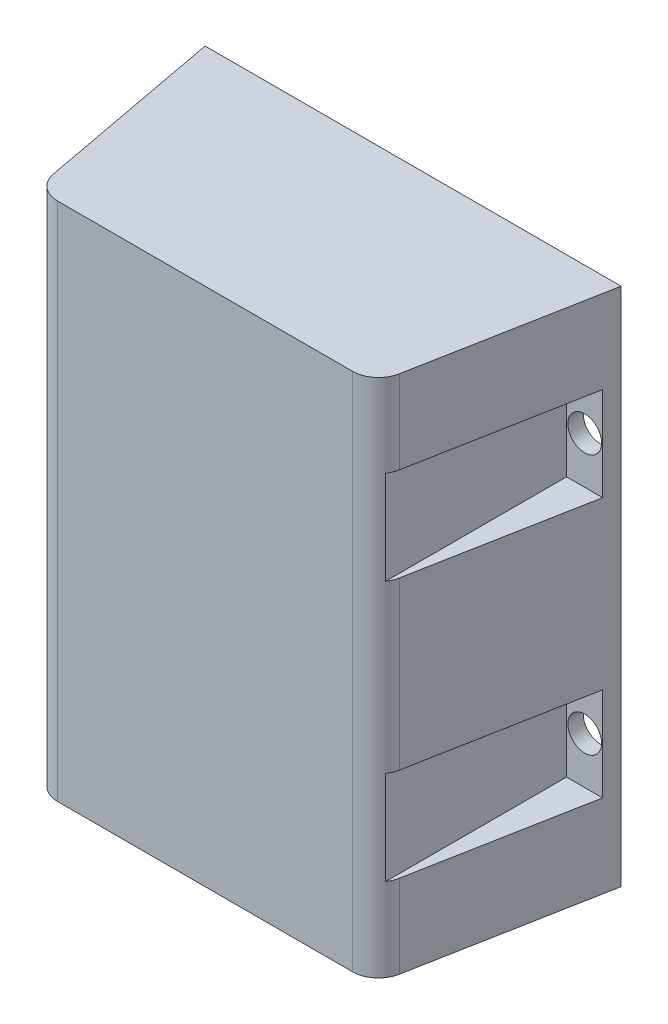
from build123d import *

# Parameters (mm, degrees)
SKETCH_1_W               = 80
SKETCH_1_H               = 100
EXTRUDE_1_DEPTH          = 40
CUT_EXTRUDE_1_DEPTH      = 115.891252931
CUT_EXTRUDE_1_DEPTH_BACK = 115.891252931
SKETCH_2_OUTSIDE_W       = 108.832
SKETCH_2_OUTSIDE_H       = 68.832
CUT_EXTRUDE_2_DEPTH      = 37
SKETCH_4_R               = 3.25
CUT_EXTRUDE_3_DEPTH      = 37
SKETCH_5_OUTSIDE_W       = 108.832
SKETCH_5_OUTSIDE_H       = 68.832
CUT_EXTRUDE_4_DEPTH      = 100


with BuildPart() as part:
    # 草图1 → 凸台-拉伸1 (new body)
    with BuildSketch(Plane.XY):
        Rectangle(SKETCH_1_W, SKETCH_1_H)
    extrude(amount=EXTRUDE_1_DEPTH)

    # 草图2 outside → 切除-拉伸1 (cut, two sides: drawn at the far end of the back side and taken through both)
    with BuildSketch(Plane(origin=(0, -50, 0), x_dir=(-1, 0, 0), z_dir=(0, -1, 0)).offset(-CUT_EXTRUDE_1_DEPTH_BACK)):
        with Locations((0, -20)):
            Rectangle(SKETCH_2_OUTSIDE_W, SKETCH_2_OUTSIDE_H)
        Polygon((0, -40), (32.5, -40), (40, 0), (-40, 0), (-32.5, -40), align=None, mode=Mode.SUBTRACT)
    extrude(amount=CUT_EXTRUDE_1_DEPTH + CUT_EXTRUDE_1_DEPTH_BACK, mode=Mode.SUBTRACT)

    # 草图3 → 切除-拉伸2 (cut)
    with BuildSketch(Plane.XY.offset(40)):
        Polygon((-40, -25), (-40, -34), (-32.5, -34), (-32.5, -16), (-40, -16), align=None)
        Polygon((-40, 16), (-40, 25), (-40, 34), (-32.5, 34), (-32.5, 16), align=None)
        Polygon((40, -16), (40, -25), (40, -34), (32.5, -34), (32.5, -16), align=None)
        Polygon((40, 25), (40, 34), (32.5, 34), (32.5, 16), (40, 16), align=None)
    extrude(amount=-CUT_EXTRUDE_2_DEPTH, mode=Mode.SUBTRACT)

    # 草图4 → 切除-拉伸3 (cut)
    with BuildSketch(Plane.XY.offset(3)):
        with Locations((-36, 25)):
            Circle(SKETCH_4_R)
        with Locations((36, 25)):
            Circle(SKETCH_4_R)
        with Locations((36, -25)):
            Circle(SKETCH_4_R)
        with Locations((-36, -25)):
            Circle(SKETCH_4_R)
    extrude(amount=-CUT_EXTRUDE_3_DEPTH, mode=Mode.SUBTRACT)

    # 草图5 outside → 切除-拉伸4 (cut)
    with BuildSketch(Plane.XZ.offset(50)):
        with Locations((0, 20)):
            Rectangle(SKETCH_5_OUTSIDE_W, SKETCH_5_OUTSIDE_H)
        with BuildLine():
            Line((-28.350368564, 40), (28.350368564, 40))
            ThreePointArc((28.350368564, 40), (31.543547749, 38.847545541), (33.264729498, 35.921442675))
            Line((33.264729498, 35.921442675), (40, 0))
            Line((40, 0), (-40, 0))
            Line((-40, 0), (-33.264729498, 35.921442675))
            ThreePointArc((-33.264729498, 35.921442675), (-31.543547749, 38.847545541), (-28.350368564, 40))
        make_face(mode=Mode.SUBTRACT)
    extrude(amount=-CUT_EXTRUDE_4_DEPTH, mode=Mode.SUBTRACT)


solid = part.part
